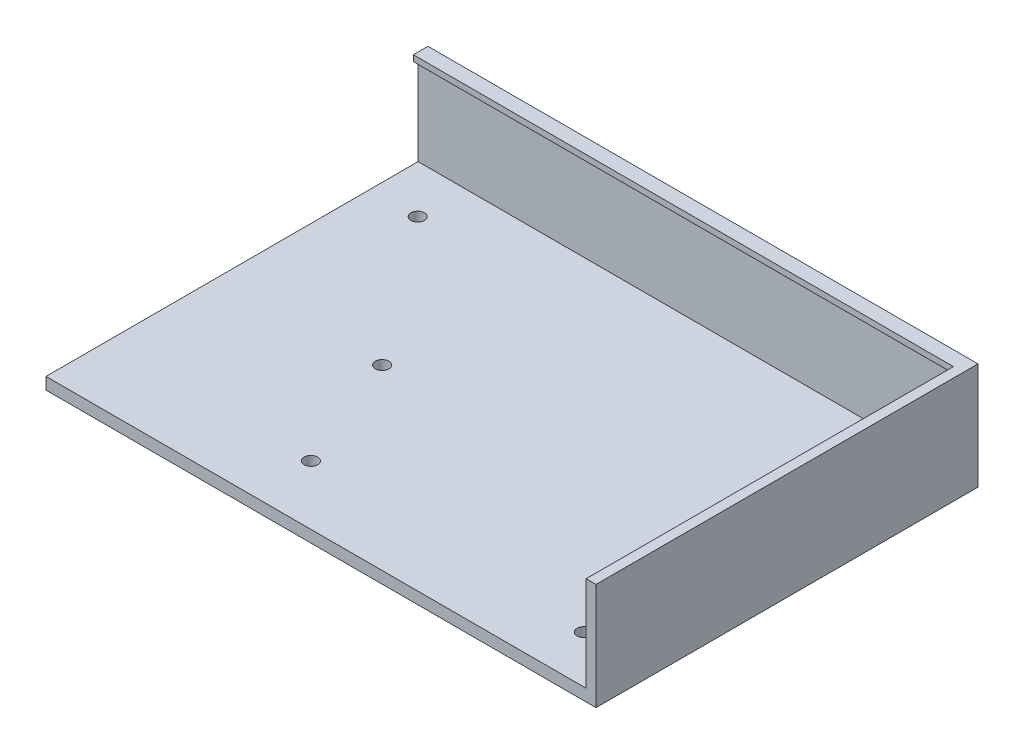
from build123d import *

# Parameters (mm, degrees)
SKETCH1_W                     = 278.2
SKETCH1_H                     = 193.2
SHELL_BLOCK_DEPTH             = 27
SKETCH2_W                     = 273.2
SKETCH2_H                     = 185.8
FRONT_OPENING_DEPTH           = 1.5
SKETCH3_W                     = 273.2
SKETCH3_H                     = 188.2
DISPLAY_POCKET_DEPTH          = 22.5
SKETCH4_W                     = 3
SKETCH4_H                     = 56
VENT_SLOTS_DEPTH              = 4
SKETCH5_W                     = 58
SKETCH5_H                     = 16
CABLE_EXIT_X_SHORT_SIDE_DEPTH = 140.1
SKETCH6_R                     = 1.7
BOLT_HOLES_DEPTH              = 4
KEEP_ONE_HALF_X_DEPTH         = 172.491603293
KEEP_ONE_HALF_X_DEPTH_BACK    = 172.491603293
SKETCH7_W                     = 200
SKETCH7_H                     = 400
KEEP_ONE_QUARTER_Z_DEPTH      = 172.491603293
KEEP_ONE_QUARTER_Z_DEPTH_BACK = 172.491603293
SKETCH8_W                     = 400
SKETCH8_H                     = 200


with BuildPart() as part:
    # Sketch1 → Shell Block (new body)
    with BuildSketch(Plane(origin=(0, 0, 0), x_dir=(1, 0, 0), z_dir=(0, 1, 0))):
        Rectangle(SKETCH1_W, SKETCH1_H)
    extrude(amount=SHELL_BLOCK_DEPTH)

    # Sketch2 → Front Opening (cut)
    with BuildSketch(Plane(origin=(0, 27, 0), x_dir=(1, 0, 0), z_dir=(0, 1, 0))):
        Rectangle(SKETCH2_W, SKETCH2_H)
    extrude(amount=-FRONT_OPENING_DEPTH, mode=Mode.SUBTRACT)

    # Sketch3 → Display Pocket (cut)
    with BuildSketch(Plane(origin=(0, 25.5, 0), x_dir=(1, 0, 0), z_dir=(0, 1, 0))):
        Rectangle(SKETCH3_W, SKETCH3_H)
    extrude(amount=-DISPLAY_POCKET_DEPTH, mode=Mode.SUBTRACT)

    # Sketch4 → Vent Slots (cut)
    with BuildSketch(Plane(origin=(0, 3, 0), x_dir=(1, 0, 0), z_dir=(0, 1, 0))):
        with Locations((-67.5, 56)):
            Rectangle(SKETCH4_W, SKETCH4_H)
        with Locations((-67.5, -56)):
            Rectangle(SKETCH4_W, SKETCH4_H)
        with Locations((-75.5, 56)):
            Rectangle(SKETCH4_W, SKETCH4_H)
        with Locations((-75.5, -56)):
            Rectangle(SKETCH4_W, SKETCH4_H)
        with Locations((-83.5, 56)):
            Rectangle(SKETCH4_W, SKETCH4_H)
        with Locations((-83.5, -56)):
            Rectangle(SKETCH4_W, SKETCH4_H)
        with Locations((-91.5, 56)):
            Rectangle(SKETCH4_W, SKETCH4_H)
        with Locations((-91.5, -56)):
            Rectangle(SKETCH4_W, SKETCH4_H)
        with Locations((-99.5, 56)):
            Rectangle(SKETCH4_W, SKETCH4_H)
        with Locations((-99.5, -56)):
            Rectangle(SKETCH4_W, SKETCH4_H)
        with Locations((-107.5, 56)):
            Rectangle(SKETCH4_W, SKETCH4_H)
        with Locations((-107.5, -56)):
            Rectangle(SKETCH4_W, SKETCH4_H)
        with Locations((-115.5, 56)):
            Rectangle(SKETCH4_W, SKETCH4_H)
        with Locations((-115.5, -56)):
            Rectangle(SKETCH4_W, SKETCH4_H)
        with Locations((-123.5, 56)):
            Rectangle(SKETCH4_W, SKETCH4_H)
        with Locations((-123.5, -56)):
            Rectangle(SKETCH4_W, SKETCH4_H)
    extrude(amount=-VENT_SLOTS_DEPTH, mode=Mode.SUBTRACT)

    # Sketch5 → Cable Exit (-X short side) (cut)
    with BuildSketch(Plane(origin=(0, 0, 0), x_dir=(0, 0, -1), z_dir=(1, 0, 0))):
        with Locations((0, 13)):
            Rectangle(SKETCH5_W, SKETCH5_H)
    extrude(amount=-CABLE_EXIT_X_SHORT_SIDE_DEPTH, mode=Mode.SUBTRACT)

    # Sketch6 → Bolt Holes (cut)
    with BuildSketch(Plane(origin=(0, 3, 0), x_dir=(1, 0, 0), z_dir=(0, 1, 0))):
        with Locations((-40, -45)):
            Circle(SKETCH6_R)
        with Locations((-40, 45)):
            Circle(SKETCH6_R)
        with Locations((40, -45)):
            Circle(SKETCH6_R)
        with Locations((40, 45)):
            Circle(SKETCH6_R)
        with Locations((-52, -15)):
            Circle(SKETCH6_R)
        with Locations((-52, 15)):
            Circle(SKETCH6_R)
        with Locations((52, -15)):
            Circle(SKETCH6_R)
        with Locations((52, 15)):
            Circle(SKETCH6_R)
        with Locations((-12, -82)):
            Circle(SKETCH6_R)
        with Locations((-12, 82)):
            Circle(SKETCH6_R)
        with Locations((12, -82)):
            Circle(SKETCH6_R)
        with Locations((12, 82)):
            Circle(SKETCH6_R)
        with Locations((-124, -12)):
            Circle(SKETCH6_R)
        with Locations((-124, 12)):
            Circle(SKETCH6_R)
        with Locations((124, -12)):
            Circle(SKETCH6_R)
        with Locations((124, 12)):
            Circle(SKETCH6_R)
        with Locations((-72, 12)):
            Circle(SKETCH6_R)
        with Locations((-72, -12)):
            Circle(SKETCH6_R)
    extrude(amount=-BOLT_HOLES_DEPTH, mode=Mode.SUBTRACT)

    # Sketch7 → Keep one half (X) (cut, two sides: drawn at the far end of the back side and taken through both)
    with BuildSketch(Plane(origin=(0, 0, 0), x_dir=(1, 0, 0), z_dir=(0, 1, 0)).offset(-KEEP_ONE_HALF_X_DEPTH_BACK)):
        with Locations((-100, 0)):
            Rectangle(SKETCH7_W, SKETCH7_H)
    extrude(amount=KEEP_ONE_HALF_X_DEPTH + KEEP_ONE_HALF_X_DEPTH_BACK, mode=Mode.SUBTRACT)

    # Sketch8 → Keep one quarter (Z) (cut, two sides: drawn at the far end of the back side and taken through both)
    with BuildSketch(Plane(origin=(0, 0, 0), x_dir=(1, 0, 0), z_dir=(0, 1, 0)).offset(-KEEP_ONE_QUARTER_Z_DEPTH_BACK)):
        with Locations((0, -100)):
            Rectangle(SKETCH8_W, SKETCH8_H)
    extrude(amount=KEEP_ONE_QUARTER_Z_DEPTH + KEEP_ONE_QUARTER_Z_DEPTH_BACK, mode=Mode.SUBTRACT)


solid = part.part
